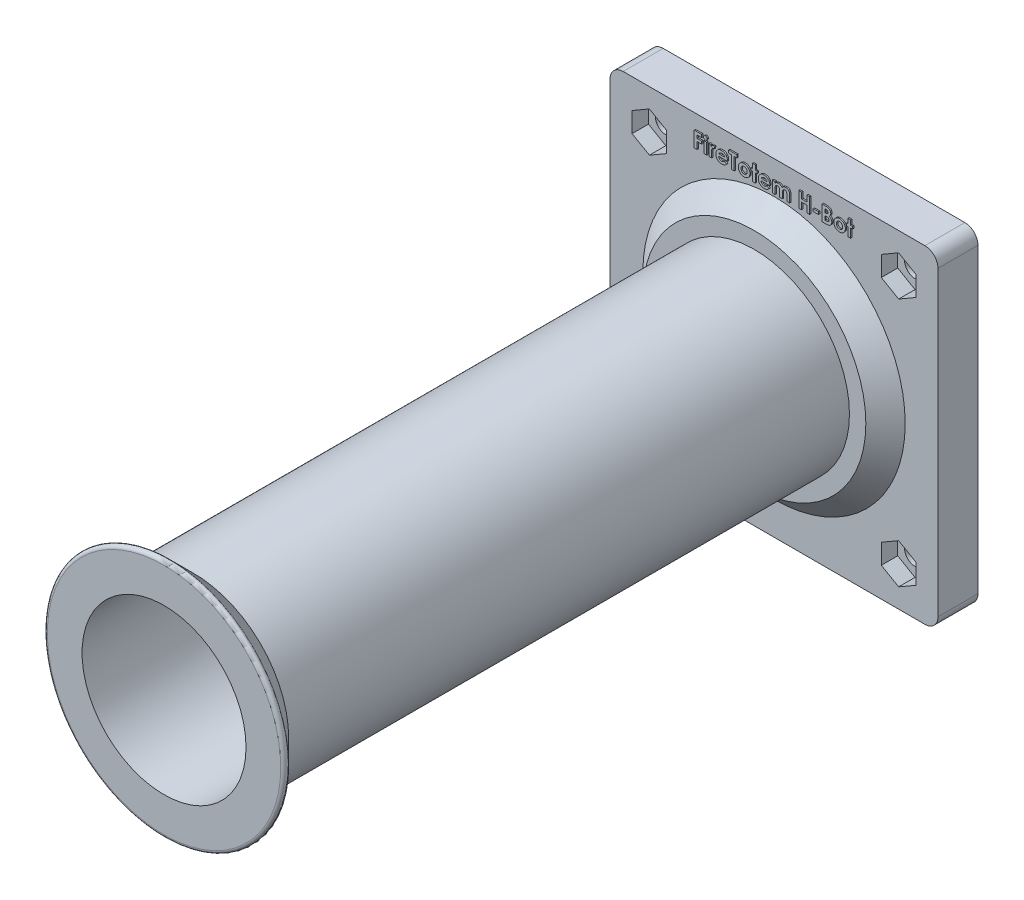
from build123d import *

# Parameters (mm, degrees)
SKETCH_1_R          = 1.6
SKETCH_1_R_2        = 12.5
EXTRUDE_1_DEPTH     = 6.1
CUT_EXTRUDE_1_DEPTH = 2.5
SKETCH_3_R          = 20
EXTRUDE_2_DEPTH     = 3
SKETCH_4_R          = 14.5
EXTRUDE_3_DEPTH     = 85
SKETCH_5_R          = 20
EXTRUDE_4_DEPTH     = 5
SKETCH_6_R          = 12.5
CUT_EXTRUDE_2_DEPTH = 106.217916725
CHAMFER_1_SIZE      = 3
CHAMFER_2_SIZE      = 6
FILLET_1_R          = 0.5
SKETCH_7_W          = 0.421794872
SKETCH_7_H          = 1.717307692
SKETCH_7_W_2        = 0.813461538
SKETCH_7_H_2        = 0.391666666
EXTRUDE_5_DEPTH     = 0.2


# Some blends are built 0.0001 mm under size
with BuildPart() as part:
    # Эскиз1 → Бобышка-Вытянуть1 (new body)
    with BuildSketch(Plane.XY):
        with BuildLine():
            Line((-23, 25), (23, 25))
            ThreePointArc((23, 25), (24.414213562, 24.414213562), (25, 23))
            Line((25, 23), (25, -23))
            ThreePointArc((25, -23), (24.414213562, -24.414213562), (23, -25))
            Line((23, -25), (-23, -25))
            ThreePointArc((-23, -25), (-24.414213562, -24.414213562), (-25, -23))
            Line((-25, -23), (-25, 23))
            ThreePointArc((-25, 23), (-24.414213562, 24.414213562), (-23, 25))
        make_face()
        with Locations((-19, 19)):
            Circle(SKETCH_1_R, mode=Mode.SUBTRACT)
        with Locations((19, 19)):
            Circle(SKETCH_1_R, mode=Mode.SUBTRACT)
        with Locations((19, -19)):
            Circle(SKETCH_1_R, mode=Mode.SUBTRACT)
        with Locations((-19, -19)):
            Circle(SKETCH_1_R, mode=Mode.SUBTRACT)
        Circle(SKETCH_1_R_2, mode=Mode.SUBTRACT)
    extrude(amount=EXTRUDE_1_DEPTH)

    # Эскиз2 → Вырез-Вытянуть1 (cut)
    with BuildSketch(Plane.XY.offset(6.1)):
        Polygon((-19, 15.95), (-16.358622518, 17.475), (-16.358622518, 20.525), (-19, 22.05), (-21.641377482, 20.525), (-21.641377482, 17.475), align=None)
        Polygon((-19, -22.05), (-16.358622518, -20.525), (-16.358622518, -17.475), (-19, -15.95), (-21.641377482, -17.475), (-21.641377482, -20.525), align=None)
        Polygon((19, 15.95), (21.641377482, 17.475), (21.641377482, 20.525), (19, 22.05), (16.358622518, 20.525), (16.358622518, 17.475), align=None)
        Polygon((19, -22.05), (21.641377482, -20.525), (21.641377482, -17.475), (19, -15.95), (16.358622518, -17.475), (16.358622518, -20.525), align=None)
    extrude(amount=-CUT_EXTRUDE_1_DEPTH, mode=Mode.SUBTRACT)

    # Эскиз3 → Бобышка-Вытянуть2 (add)
    with BuildSketch(Plane.XY.offset(6.1)):
        Circle(SKETCH_3_R)
    extrude(amount=EXTRUDE_2_DEPTH)

    # Эскиз4 → Бобышка-Вытянуть3 (add)
    with BuildSketch(Plane.XY.offset(9.1)):
        Circle(SKETCH_4_R)
    extrude(amount=EXTRUDE_3_DEPTH)

    # Эскиз5 → Бобышка-Вытянуть4 (add)
    with BuildSketch(Plane.XY.offset(94.1)):
        Circle(SKETCH_5_R)
    extrude(amount=EXTRUDE_4_DEPTH)

    # Эскиз6 → Вырез-Вытянуть2 (cut, through all)
    with BuildSketch(Plane.XY.offset(99.1)):
        Circle(SKETCH_6_R)
    extrude(amount=-CUT_EXTRUDE_2_DEPTH, mode=Mode.SUBTRACT)

    # Фаска1
    chamfer_1_edges = [part.edges().sort_by_distance(p)[0] for p in [
        (-20, 0, 9.1),
    ]]
    chamfer(chamfer_1_edges, length=CHAMFER_1_SIZE - 0.0001)  # a hair under: the kernel refuses the full size

    # Фаска2
    # the kernel refuses this chamfer: 6 mm, written as the material it takes off along each edge
    with BuildSketch(Plane(origin=(0, 0, 94.1), x_dir=(1, 0, 0), z_dir=(0, -1, 0))) as chamfer_2_piece_1_section:
        Polygon((20 - CHAMFER_2_SIZE, 0), (20, CHAMFER_2_SIZE), (20, 0), align=None)
    chamfer_2_piece_1 = revolve(axis=Axis((0, 0, 94.1), (0, 0, 1)), mode=Mode.PRIVATE)
    chamfer_2_piece_1 = chamfer_2_piece_1 - Plane(origin=(0, 0, 97.342648178), x_dir=(1, 0, 0), z_dir=(0, 0, -1)) * Cylinder(14.5, 80, mode=Mode.PRIVATE)
    add(chamfer_2_piece_1, mode=Mode.SUBTRACT)

    # Скругление1
    fillet_1_edges = [part.edges().sort_by_distance(p)[0] for p in [
        (-19, 0, 99.1),
    ]]
    fillet(fillet_1_edges, radius=FILLET_1_R)

    # Эскиз7 → Бобышка-Вытянуть5 (add)
    # profile 1 of 15: a face of its own
    with BuildSketch(Plane.XY.offset(6.1)):
        Polygon((-11.965308917, 22.875), (-10.820437122, 22.875), (-10.820437122, 22.453205128), (-11.543514045, 22.453205128), (-11.543514045, 22.001282051), (-10.820437122, 22.001282051), (-10.820437122, 21.579487179), (-11.543514045, 21.579487179), (-11.543514045, 20.525), (-11.965308917, 20.525), align=None)
    # profile 2 of 15: a face of its own
    with BuildSketch(Plane.XY.offset(6.1)):
        with BuildLine():
            add(Edge.make_bspline(
                [(-10.279070936, 22.965384615), (-10.26089158, 22.964492667), (-10.225194663, 22.962741242), (-10.174053972, 22.945668735), (-10.127117182, 22.918873947), (-10.085623758, 22.882110859), (-10.051113408, 22.838209008), (-10.024746218, 22.789057967), (-10.010058156, 22.734600197), (-10.008018201, 22.696981338), (-10.006975584, 22.677754407)],
                knots=[0, 0, 0, 0, 0.989868614, 1.943702388, 2.910836514, 3.924849579, 4.949916355, 5.946401046, 6.950409252, 8, 8, 8, 8], degree=3))
            add(Edge.make_bspline(
                [(-10.006975584, 22.677754407), (-10.007980898, 22.658669168), (-10.0099398, 22.62148067), (-10.025084273, 22.567762189), (-10.050393175, 22.518635021), (-10.085183038, 22.475385194), (-10.126226619, 22.439214197), (-10.172137804, 22.411932966), (-10.222788419, 22.395810199), (-10.257931428, 22.393912364), (-10.275775664, 22.392948718)],
                knots=[0, 0, 0, 0, 1.05296456, 2.051751585, 3.055639087, 4.085634717, 5.099016424, 6.062201612, 7.016062274, 8, 8, 8, 8], degree=3))
            add(Edge.make_bspline(
                [(-10.275775664, 22.392948718), (-10.294113711, 22.393837477), (-10.33012119, 22.395582592), (-10.38168134, 22.412695044), (-10.429244147, 22.439278805), (-10.470557573, 22.47679302), (-10.505463143, 22.521006827), (-10.530678603, 22.571302147), (-10.546451497, 22.626132299), (-10.548323726, 22.664308318), (-10.549283276, 22.683874199)],
                knots=[0, 0, 0, 0, 0.989065327, 1.942068821, 2.907541208, 3.917690034, 4.939857478, 5.938239964, 6.943311734, 8, 8, 8, 8], degree=3))
            add(Edge.make_bspline(
                [(-10.549283276, 22.683874199), (-10.548239023, 22.702635359), (-10.546187739, 22.739488951), (-10.531411694, 22.792735965), (-10.505649103, 22.841060701), (-10.471387334, 22.884158887), (-10.430258362, 22.920236205), (-10.383349749, 22.946217218), (-10.332553236, 22.962584581), (-10.297082446, 22.964441633), (-10.279070936, 22.965384615)],
                knots=[0, 0, 0, 0, 1.038616768, 2.040212704, 3.031499824, 4.052181184, 5.074969369, 6.039807101, 7.004644834, 8, 8, 8, 8], degree=3))
        make_face()
    # profile 3 of 15: a face of its own
    with BuildSketch(Plane.XY.offset(6.1)):
        with Locations((-10.27812943, 21.383653846)):
            Rectangle(SKETCH_7_W, SKETCH_7_H)
    # profile 4 of 15: a face of its own
    with BuildSketch(Plane.XY.offset(6.1)):
        with BuildLine():
            Line((-9.735821738, 22.242307692), (-9.374283276, 22.242307692))
            Line((-9.374283276, 22.242307692), (-9.374283276, 22.030939503))
            add(Edge.make_bspline(
                [(-9.374283276, 22.030939503), (-9.364056047, 22.049723852), (-9.344066504, 22.086438642), (-9.307344036, 22.135720976), (-9.265155778, 22.177225183), (-9.219017684, 22.211819361), (-9.168789918, 22.238782126), (-9.115817491, 22.257996495), (-9.06055358, 22.270483173), (-9.022854414, 22.271780302), (-9.003800504, 22.272435897)],
                knots=[0, 0, 0, 0, 1.09866127, 2.147379032, 3.14564304, 4.131443017, 5.102343063, 6.064490016, 7.021754664, 8, 8, 8, 8], degree=3))
            add(Edge.make_bspline(
                [(-9.003800504, 22.272435897), (-8.989964987, 22.271788032), (-8.961790936, 22.270468748), (-8.918849716, 22.262799727), (-8.87528893, 22.248932679), (-8.84662218, 22.236447245), (-8.831975584, 22.230068109)],
                knots=[0, 0, 0, 0, 0.931404136, 1.896671404, 2.925354185, 4, 4, 4, 4], degree=3))
            Line((-8.831975584, 22.230068109), (-8.962844975, 21.872766426))
            add(Edge.make_bspline(
                [(-8.962844975, 21.872766426), (-8.97454283, 21.878418264), (-8.996530293, 21.889041544), (-9.028452273, 21.901578108), (-9.057422793, 21.909227306), (-9.075789571, 21.910368634), (-9.084299302, 21.910897436)],
                knots=[0, 0, 0, 0, 1.214386998, 2.282580073, 3.20428172, 4, 4, 4, 4], degree=3))
            add(Edge.make_bspline(
                [(-9.084299302, 21.910897436), (-9.092334142, 21.910547024), (-9.108140058, 21.909857703), (-9.131469148, 21.903950455), (-9.153440292, 21.893763589), (-9.17511228, 21.880713204), (-9.194775431, 21.862572191), (-9.214426436, 21.841570749), (-9.231743954, 21.815641674), (-9.250018958, 21.786781297), (-9.265579471, 21.751456222), (-9.278922131, 21.709285362), (-9.290810548, 21.659780771), (-9.298991403, 21.602679605), (-9.306898527, 21.538534414), (-9.311605041, 21.466874383), (-9.315112866, 21.387926106), (-9.315327346, 21.332817359), (-9.315439126, 21.304096554)],
                knots=[0, 0, 0, 0, 0.544232178, 1.070598461, 1.618251235, 2.182094276, 2.777567932, 3.425210017, 4.127676488, 4.886675562, 5.738955394, 6.734782583, 7.883056018, 9.186093582, 10.642914445, 12.264202625, 14.053029461, 16, 16, 16, 16], degree=3))
            Line((-9.315439126, 21.304096554), (-9.314026866, 21.220302484))
            Line((-9.314026866, 21.220302484), (-9.314026866, 20.525))
            Line((-9.314026866, 20.525), (-9.735821738, 20.525))
            Line((-9.735821738, 20.525), (-9.735821738, 22.242307692))
        make_face()
    # profile 5 of 15: a face of its own
    with BuildSketch(Plane.XY.offset(6.1)):
        with BuildLine():
            Line((-6.905182715, 21.278205128), (-8.259539686, 21.278205128))
            add(Edge.make_bspline(
                [(-8.259539686, 21.278205128), (-8.256778262, 21.262468269), (-8.251351845, 21.231544098), (-8.239568188, 21.186624056), (-8.224530473, 21.144292167), (-8.20650872, 21.104491844), (-8.185806774, 21.067012677), (-8.161659669, 21.032030458), (-8.134373689, 20.999576087), (-8.104106594, 20.969790612), (-8.071362883, 20.943102182), (-8.036301349, 20.919721429), (-7.998885811, 20.900550643), (-7.959545226, 20.884391659), (-7.917985627, 20.871592107), (-7.874145849, 20.862764499), (-7.828142106, 20.857549999), (-7.79680295, 20.856795781), (-7.780783677, 20.856410256)],
                knots=[0, 0, 0, 0, 1.091296461, 2.144483647, 3.168565212, 4.157007626, 5.126487748, 6.090021542, 7.05641414, 8.019231907, 8.98705074, 9.938580405, 10.892824166, 11.854447369, 12.841318655, 13.858982407, 14.905600794, 16, 16, 16, 16], degree=3))
            add(Edge.make_bspline(
                [(-7.780783677, 20.856410256), (-7.761447326, 20.856920755), (-7.723368357, 20.857926076), (-7.667582384, 20.866841785), (-7.613629222, 20.880308572), (-7.562019457, 20.900334815), (-7.512155273, 20.925263966), (-7.464857586, 20.956322621), (-7.41930771, 20.992603145), (-7.391516918, 21.020568159), (-7.37734818, 21.034825721)],
                knots=[0, 0, 0, 0, 1.021034703, 2.010718019, 2.977989445, 3.954245119, 4.929443971, 5.918328161, 6.938689359, 8, 8, 8, 8], degree=3))
            Line((-7.37734818, 21.034825721), (-7.024283276, 20.866766827))
            add(Edge.make_bspline(
                [(-7.024283276, 20.866766827), (-7.035399319, 20.851406162), (-7.057425348, 20.82096957), (-7.093382102, 20.778137425), (-7.130905264, 20.738173295), (-7.170022819, 20.701340032), (-7.210784378, 20.667742595), (-7.253076552, 20.636971707), (-7.297517424, 20.609853555), (-7.343218407, 20.585076177), (-7.391124224, 20.563834646), (-7.4411023, 20.545720619), (-7.492940948, 20.529345692), (-7.54729478, 20.516868895), (-7.603711191, 20.506992364), (-7.662325139, 20.499978718), (-7.723128901, 20.495646726), (-7.764456864, 20.495133173), (-7.785491209, 20.494871795)],
                knots=[0, 0, 0, 0, 1.028154879, 2.037251081, 3.030720504, 4.000128189, 4.949298328, 5.894184978, 6.834267904, 7.770992897, 8.712077017, 9.673380525, 10.653304757, 11.658697181, 12.695551717, 13.758623199, 14.859225354, 16, 16, 16, 16], degree=3))
            add(Edge.make_bspline(
                [(-7.785491209, 20.494871795), (-7.817852203, 20.495531538), (-7.881229344, 20.496823607), (-7.97392987, 20.508815859), (-8.061969659, 20.528700305), (-8.145597303, 20.555730155), (-8.224451309, 20.591418026), (-8.298570701, 20.635067252), (-8.368696038, 20.68584099), (-8.432684601, 20.744804846), (-8.490980069, 20.808983498), (-8.542183184, 20.877906988), (-8.585029221, 20.951093774), (-8.620215248, 21.028059489), (-8.647563051, 21.109001136), (-8.667279231, 21.193954036), (-8.679365485, 21.282877615), (-8.680670861, 21.343444498), (-8.681334558, 21.374238782)],
                knots=[0, 0, 0, 0, 1.103565453, 2.161269334, 3.182010356, 4.179077853, 5.15417608, 6.128274628, 7.109042802, 8.101804412, 9.090965879, 10.063106201, 11.02526161, 11.978650795, 12.945248442, 13.93468508, 14.949922959, 16, 16, 16, 16], degree=3))
            add(Edge.make_bspline(
                [(-8.681334558, 21.374238782), (-8.680664328, 21.405815588), (-8.679345681, 21.467941536), (-8.667383293, 21.5589184), (-8.647508543, 21.645722635), (-8.620080741, 21.728473777), (-8.58542849, 21.807430637), (-8.542037311, 21.881902437), (-8.491005478, 21.952148447), (-8.432920018, 22.017840051), (-8.368660381, 22.077133899), (-8.300378445, 22.129976568), (-8.227306993, 22.174008587), (-8.150272526, 22.209586431), (-8.069767784, 22.238492532), (-7.984862245, 22.257727127), (-7.896201911, 22.270642007), (-7.835595659, 22.271831386), (-7.80479209, 22.272435897)],
                knots=[0, 0, 0, 0, 1.079208495, 2.12329425, 3.130605359, 4.119693003, 5.099659317, 6.073216462, 7.060498243, 8.06384408, 9.066070512, 10.045757761, 11.010926815, 11.975797609, 12.942977511, 13.929384301, 14.947594487, 16, 16, 16, 16], degree=3))
            add(Edge.make_bspline(
                [(-7.80479209, 22.272435897), (-7.772276065, 22.271765919), (-7.708434201, 22.270450485), (-7.615088045, 22.258555607), (-7.526463683, 22.238549908), (-7.442183526, 22.21175378), (-7.363323867, 22.175164397), (-7.28815192, 22.132589309), (-7.218470734, 22.080718058), (-7.153537582, 22.022042752), (-7.094922141, 21.956944533), (-7.043685752, 21.886227929), (-7.000089891, 21.810583093), (-6.964755012, 21.729703268), (-6.937435291, 21.643831264), (-6.91770086, 21.553078603), (-6.905706795, 21.457100104), (-6.90442571, 21.391378125), (-6.903770456, 21.35776242)],
                knots=[0, 0, 0, 0, 1.080001299, 2.120471247, 3.119684163, 4.095710327, 5.052285597, 6.002875087, 6.961153713, 7.931888285, 8.906493152, 9.865905668, 10.82813294, 11.801621613, 12.7925306, 13.817193356, 14.883530496, 16, 16, 16, 16], degree=3))
            Line((-6.903770456, 21.35776242), (-6.905182715, 21.278205128))
        make_face()
        with BuildLine():
            add(Edge.make_bspline(
                [(-7.325565327, 21.609615385), (-7.333524855, 21.631094924), (-7.349350468, 21.673801845), (-7.385099871, 21.732726974), (-7.432538184, 21.783758529), (-7.487712345, 21.82893717), (-7.550752279, 21.865606977), (-7.619671488, 21.892157108), (-7.693598844, 21.908076899), (-7.744456882, 21.909944011), (-7.770427106, 21.910897436)],
                knots=[0, 0, 0, 0, 0.954238005, 1.897273737, 2.851915805, 3.847685534, 4.862635127, 5.880135777, 6.917509367, 8, 8, 8, 8], degree=3))
            add(Edge.make_bspline(
                [(-7.770427106, 21.910897436), (-7.79879082, 21.909981555), (-7.854235973, 21.908191199), (-7.934211832, 21.889150108), (-8.009651059, 21.860731847), (-8.054125752, 21.831432016), (-8.07641669, 21.816746795)],
                knots=[0, 0, 0, 0, 1.044195649, 2.041185066, 3.018232172, 4, 4, 4, 4], degree=3))
            add(Edge.make_bspline(
                [(-8.07641669, 21.816746795), (-8.09032457, 21.805562209), (-8.11997546, 21.781717243), (-8.158483157, 21.734148799), (-8.196413558, 21.676554092), (-8.217979083, 21.632806844), (-8.229411481, 21.609615385)],
                knots=[0, 0, 0, 0, 0.82159062, 1.751589201, 2.808063854, 4, 4, 4, 4], degree=3))
            Line((-8.229411481, 21.609615385), (-7.325565327, 21.609615385))
        make_face(mode=Mode.SUBTRACT)
    # profile 6 of 15: a face of its own
    with BuildSketch(Plane.XY.offset(6.1)):
        Polygon((-6.723001225, 22.875), (-5.45761661, 22.875), (-5.45761661, 22.453205128), (-5.879411481, 22.453205128), (-5.879411481, 20.525), (-6.301206353, 20.525), (-6.301206353, 22.453205128), (-6.723001225, 22.453205128), align=None)
    # profile 7 of 15: a face of its own
    with BuildSketch(Plane.XY.offset(6.1)):
        with BuildLine():
            add(Edge.make_bspline(
                [(-4.368293693, 22.272435897), (-4.348352046, 22.272081022), (-4.308858548, 22.271378208), (-4.250037917, 22.265527925), (-4.192245606, 22.255982947), (-4.135149434, 22.243623866), (-4.07927959, 22.226306946), (-4.024343044, 22.205537977), (-3.969848595, 22.181692772), (-3.917148783, 22.153308638), (-3.865862892, 22.122523456), (-3.817240815, 22.088564874), (-3.771686324, 22.051699626), (-3.728353775, 22.01278246), (-3.689262532, 21.970119052), (-3.651914457, 21.925765102), (-3.618327374, 21.878131564), (-3.587230574, 21.828379157), (-3.559545317, 21.776795588), (-3.535505762, 21.723739693), (-3.514641689, 21.669945005), (-3.498305538, 21.61475627), (-3.48478071, 21.558901223), (-3.476245583, 21.501695403), (-3.470177699, 21.443726458), (-3.469497297, 21.404696994), (-3.469155071, 21.385066106)],
                knots=[0, 0, 0, 0, 1.022364134, 2.024744242, 3.027414945, 4.024939316, 5.017584196, 6.023349371, 7.035562955, 8.064994934, 9.090267829, 10.101425541, 11.102933353, 12.093946398, 13.084502048, 14.067315274, 15.065326281, 16.070028806, 17.074376865, 18.064572984, 19.055292013, 20.030201733, 21.013838017, 21.999348303, 22.993720005, 24, 24, 24, 24], degree=3))
            add(Edge.make_bspline(
                [(-3.469155071, 21.385066106), (-3.469516234, 21.365281852), (-3.470234308, 21.325946269), (-3.476026054, 21.267432054), (-3.485607568, 21.209957222), (-3.498014083, 21.153183179), (-3.515266199, 21.097836403), (-3.535423455, 21.04310106), (-3.560167279, 20.989723214), (-3.5875234, 20.937120563), (-3.61882014, 20.886841042), (-3.652378149, 20.838730331), (-3.689569792, 20.794050599), (-3.728348098, 20.751416204), (-3.77055241, 20.71226885), (-3.815509069, 20.675972888), (-3.862828873, 20.642084585), (-3.912852104, 20.611399023), (-3.964938046, 20.584436713), (-4.01820828, 20.560127991), (-4.072974301, 20.539889245), (-4.129122767, 20.523385104), (-4.186687731, 20.510606361), (-4.245542105, 20.501925609), (-4.305559136, 20.495888246), (-4.345996249, 20.495212793), (-4.36641068, 20.494871795)],
                knots=[0, 0, 0, 0, 1.012026251, 2.012137606, 3.004615893, 3.992048833, 4.982446996, 5.968083444, 6.973977695, 7.990229942, 8.999482246, 10.001782172, 10.988562221, 11.971415814, 12.948383116, 13.930088534, 14.925840678, 15.924049238, 16.929462851, 17.924729459, 18.917889337, 19.913673841, 20.916777188, 21.931792057, 22.95587778, 24, 24, 24, 24], degree=3))
            add(Edge.make_bspline(
                [(-4.36641068, 20.494871795), (-4.396260741, 20.495747953), (-4.455095665, 20.497474874), (-4.541745598, 20.509303831), (-4.62498758, 20.529664568), (-4.704957252, 20.558046986), (-4.781758498, 20.594417998), (-4.854721058, 20.639432647), (-4.92457071, 20.692204726), (-4.990097605, 20.752288199), (-5.050129117, 20.81820521), (-5.102573867, 20.888571217), (-5.147103703, 20.962331553), (-5.183678562, 21.039570329), (-5.211906896, 21.12039346), (-5.232292569, 21.204559314), (-5.244135988, 21.292304467), (-5.245848303, 21.351921056), (-5.246719174, 21.382241587)],
                knots=[0, 0, 0, 0, 1.029999031, 2.030143771, 3.011211297, 3.982305373, 4.953580601, 5.938004764, 6.935448627, 7.970290061, 9.001484052, 10.007591832, 10.993831261, 11.969999897, 12.951306496, 13.942897864, 14.953773953, 16, 16, 16, 16], degree=3))
            add(Edge.make_bspline(
                [(-5.246719174, 21.382241587), (-5.245817934, 21.414617266), (-5.244046564, 21.478251017), (-5.229981113, 21.571475912), (-5.207520104, 21.66073433), (-5.175278741, 21.745776589), (-5.134093235, 21.826759536), (-5.083815066, 21.903512369), (-5.024195756, 21.976052475), (-4.978539303, 22.019927218), (-4.95532294, 22.04223758)],
                knots=[0, 0, 0, 0, 1.043912699, 2.05178951, 3.033892, 4.007821512, 4.978932272, 5.95884105, 6.962068106, 8, 8, 8, 8], degree=3))
            add(Edge.make_bspline(
                [(-4.95532294, 22.04223758), (-4.934019605, 22.060730361), (-4.891992537, 22.097212788), (-4.823712382, 22.143484767), (-4.753801209, 22.18344964), (-4.681421101, 22.216308198), (-4.606370282, 22.241083021), (-4.529033344, 22.259116876), (-4.449426369, 22.270193798), (-4.395475354, 22.271684733), (-4.368293693, 22.272435897)],
                knots=[0, 0, 0, 0, 1.048115528, 2.067714963, 3.060638214, 4.039924844, 5.017819947, 5.994373833, 6.98952318, 8, 8, 8, 8], degree=3))
        make_face()
        with BuildLine():
            add(Edge.make_bspline(
                [(-4.358878629, 21.880769231), (-4.375209369, 21.880226451), (-4.407356606, 21.879157983), (-4.454678184, 21.873423803), (-4.499435431, 21.861671107), (-4.542517309, 21.846724894), (-4.583161695, 21.826736441), (-4.622481695, 21.803345344), (-4.658432755, 21.774074264), (-4.692754662, 21.741966032), (-4.723911303, 21.706310701), (-4.750459719, 21.667464245), (-4.774181318, 21.626912847), (-4.792168203, 21.583171871), (-4.80705407, 21.537436884), (-4.817128646, 21.488968948), (-4.824139848, 21.438309476), (-4.82466033, 21.40360739), (-4.824924302, 21.386007612)],
                knots=[0, 0, 0, 0, 1.030650113, 2.02884584, 2.99876339, 3.944280128, 4.900564847, 5.851248946, 6.823638398, 7.81794922, 8.81432732, 9.802856497, 10.78262424, 11.771747962, 12.779760563, 13.812642396, 14.89064281, 16, 16, 16, 16], degree=3))
            add(Edge.make_bspline(
                [(-4.824924302, 21.386007612), (-4.824615419, 21.367787177), (-4.824011766, 21.332178837), (-4.817760819, 21.280185871), (-4.8074528, 21.230844892), (-4.792808336, 21.184232119), (-4.77439045, 21.140012972), (-4.751793839, 21.098435552), (-4.724780022, 21.059749845), (-4.69415291, 21.024003492), (-4.660617531, 20.991556132), (-4.623872084, 20.963711021), (-4.58545533, 20.939517316), (-4.54448194, 20.920086036), (-4.501533851, 20.905083512), (-4.45648357, 20.894037658), (-4.409094357, 20.888086687), (-4.376782403, 20.887061633), (-4.360290888, 20.886538462)],
                knots=[0, 0, 0, 0, 1.141730614, 2.231293227, 3.276944405, 4.297399982, 5.28939179, 6.275415646, 7.257752684, 8.24146775, 9.222424823, 10.176631434, 11.126518621, 12.063689483, 13.012557477, 13.974037417, 14.965980454, 16, 16, 16, 16], degree=3))
            add(Edge.make_bspline(
                [(-4.360290888, 20.886538462), (-4.343791125, 20.887002491), (-4.311442011, 20.887912258), (-4.263997149, 20.894724977), (-4.218716808, 20.905446854), (-4.175401909, 20.9205785), (-4.134402658, 20.940425696), (-4.095562105, 20.964735147), (-4.058538565, 20.992967558), (-4.024553138, 21.026027138), (-3.993093478, 21.061884972), (-3.965505237, 21.100774897), (-3.942451463, 21.142352329), (-3.923543241, 21.186355661), (-3.908870068, 21.232724411), (-3.898732701, 21.281630926), (-3.891717751, 21.332923641), (-3.89120904, 21.368094426), (-3.890949943, 21.386007612)],
                knots=[0, 0, 0, 0, 1.031504075, 2.022346795, 2.991027682, 3.937587355, 4.885570121, 5.833146507, 6.798790848, 7.791235734, 8.792807298, 9.778388351, 10.766749885, 11.760164525, 12.768777521, 13.802286646, 14.880660483, 16, 16, 16, 16], degree=3))
            add(Edge.make_bspline(
                [(-3.890949943, 21.386007612), (-3.891262755, 21.403914538), (-3.891876595, 21.439053735), (-3.898127988, 21.490415823), (-3.908334846, 21.539164259), (-3.923168192, 21.58509089), (-3.941476605, 21.628719668), (-3.964088834, 21.669827272), (-3.991235875, 21.708211237), (-4.022011873, 21.743681235), (-4.056049969, 21.775673285), (-4.092157426, 21.804202427), (-4.131159912, 21.82779822), (-4.172325716, 21.847249576), (-4.215764361, 21.862214618), (-4.261427079, 21.873323072), (-4.309453813, 21.879189363), (-4.342231507, 21.880237104), (-4.358878629, 21.880769231)],
                knots=[0, 0, 0, 0, 1.123894411, 2.205445421, 3.243160173, 4.246488011, 5.231014757, 6.210004299, 7.185865357, 8.177612767, 9.153374344, 10.115157457, 11.061423229, 12.009021698, 12.96873347, 13.94135618, 14.954456845, 16, 16, 16, 16], degree=3))
        make_face(mode=Mode.SUBTRACT)
    # profile 8 of 15: a face of its own
    with BuildSketch(Plane.XY.offset(6.1)):
        Polygon((-3.077488404, 22.93525641), (-2.655693533, 22.93525641), (-2.655693533, 22.242307692), (-2.384539686, 22.242307692), (-2.384539686, 21.880769231), (-2.655693533, 21.880769231), (-2.655693533, 20.525), (-3.077488404, 20.525), (-3.077488404, 21.880769231), (-3.28838584, 21.880769231), (-3.28838584, 22.242307692), (-3.077488404, 22.242307692), align=None)
    # profile 9 of 15: a face of its own
    with BuildSketch(Plane.XY.offset(6.1)):
        with BuildLine():
            Line((-0.427618613, 21.278205128), (-1.781975584, 21.278205128))
            add(Edge.make_bspline(
                [(-1.781975584, 21.278205128), (-1.779214159, 21.262468269), (-1.773787742, 21.231544098), (-1.762004085, 21.186624056), (-1.746966371, 21.144292167), (-1.728944617, 21.104491844), (-1.708242671, 21.067012677), (-1.684095566, 21.032030458), (-1.656809586, 20.999576087), (-1.626542492, 20.969790612), (-1.59379878, 20.943102182), (-1.558737246, 20.919721429), (-1.521321709, 20.900550643), (-1.481981123, 20.884391659), (-1.440421524, 20.871592107), (-1.396581747, 20.862764499), (-1.350578003, 20.857549999), (-1.319238848, 20.856795781), (-1.303219574, 20.856410256)],
                knots=[0, 0, 0, 0, 1.091296461, 2.144483647, 3.168565212, 4.157007626, 5.126487748, 6.090021542, 7.05641414, 8.019231907, 8.98705074, 9.938580405, 10.892824166, 11.854447369, 12.841318655, 13.858982407, 14.905600794, 16, 16, 16, 16], degree=3))
            add(Edge.make_bspline(
                [(-1.303219574, 20.856410256), (-1.283883224, 20.856920755), (-1.245804254, 20.857926076), (-1.190018281, 20.866841785), (-1.136065119, 20.880308572), (-1.084455355, 20.900334815), (-1.03459117, 20.925263966), (-0.987293483, 20.956322621), (-0.941743607, 20.992603145), (-0.913952816, 21.020568159), (-0.899784077, 21.034825721)],
                knots=[0, 0, 0, 0, 1.021034703, 2.010718019, 2.977989445, 3.954245119, 4.929443971, 5.918328161, 6.938689359, 8, 8, 8, 8], degree=3))
            Line((-0.899784077, 21.034825721), (-0.546719174, 20.866766827))
            add(Edge.make_bspline(
                [(-0.546719174, 20.866766827), (-0.557835216, 20.851406162), (-0.579861245, 20.82096957), (-0.615817999, 20.778137425), (-0.653341161, 20.738173295), (-0.692458716, 20.701340032), (-0.733220275, 20.667742595), (-0.775512449, 20.636971707), (-0.819953322, 20.609853555), (-0.865654304, 20.585076177), (-0.913560122, 20.563834646), (-0.963538197, 20.545720619), (-1.015376846, 20.529345692), (-1.069730677, 20.516868895), (-1.126147088, 20.506992364), (-1.184761037, 20.499978718), (-1.245564799, 20.495646726), (-1.286892762, 20.495133173), (-1.307927106, 20.494871795)],
                knots=[0, 0, 0, 0, 1.028154879, 2.037251081, 3.030720504, 4.000128189, 4.949298328, 5.894184978, 6.834267904, 7.770992897, 8.712077017, 9.673380525, 10.653304757, 11.658697181, 12.695551717, 13.758623199, 14.859225354, 16, 16, 16, 16], degree=3))
            add(Edge.make_bspline(
                [(-1.307927106, 20.494871795), (-1.3402881, 20.495531538), (-1.403665242, 20.496823607), (-1.496365768, 20.508815859), (-1.584405556, 20.528700305), (-1.6680332, 20.555730155), (-1.746887206, 20.591418026), (-1.821006598, 20.635067252), (-1.891131936, 20.68584099), (-1.955120498, 20.744804846), (-2.013415966, 20.808983498), (-2.064619081, 20.877906988), (-2.107465118, 20.951093774), (-2.142651146, 21.028059489), (-2.169998949, 21.109001136), (-2.189715128, 21.193954036), (-2.201801382, 21.282877615), (-2.203106758, 21.343444498), (-2.203770456, 21.374238782)],
                knots=[0, 0, 0, 0, 1.103565453, 2.161269334, 3.182010356, 4.179077853, 5.15417608, 6.128274628, 7.109042802, 8.101804412, 9.090965879, 10.063106201, 11.02526161, 11.978650795, 12.945248442, 13.93468508, 14.949922959, 16, 16, 16, 16], degree=3))
            add(Edge.make_bspline(
                [(-2.203770456, 21.374238782), (-2.203100226, 21.405815588), (-2.201781579, 21.467941536), (-2.189819191, 21.5589184), (-2.16994444, 21.645722635), (-2.142516639, 21.728473777), (-2.107864388, 21.807430637), (-2.064473208, 21.881902437), (-2.013441376, 21.952148447), (-1.955355916, 22.017840051), (-1.891096278, 22.077133899), (-1.822814342, 22.129976568), (-1.74974289, 22.174008587), (-1.672708423, 22.209586431), (-1.592203681, 22.238492532), (-1.507298143, 22.257727127), (-1.418637809, 22.270642007), (-1.358031557, 22.271831386), (-1.327227988, 22.272435897)],
                knots=[0, 0, 0, 0, 1.079208495, 2.12329425, 3.130605359, 4.119693003, 5.099659317, 6.073216462, 7.060498243, 8.06384408, 9.066070512, 10.045757761, 11.010926815, 11.975797609, 12.942977511, 13.929384301, 14.947594487, 16, 16, 16, 16], degree=3))
            add(Edge.make_bspline(
                [(-1.327227988, 22.272435897), (-1.294711963, 22.271765919), (-1.230870099, 22.270450485), (-1.137523942, 22.258555607), (-1.04889958, 22.238549908), (-0.964619424, 22.21175378), (-0.885759765, 22.175164397), (-0.810587817, 22.132589309), (-0.740906631, 22.080718058), (-0.675973479, 22.022042752), (-0.617358039, 21.956944533), (-0.566121649, 21.886227929), (-0.522525788, 21.810583093), (-0.48719091, 21.729703268), (-0.459871188, 21.643831264), (-0.440136758, 21.553078603), (-0.428142693, 21.457100104), (-0.426861607, 21.391378125), (-0.426206353, 21.35776242)],
                knots=[0, 0, 0, 0, 1.080001299, 2.120471247, 3.119684163, 4.095710327, 5.052285597, 6.002875087, 6.961153713, 7.931888285, 8.906493152, 9.865905668, 10.82813294, 11.801621613, 12.7925306, 13.817193356, 14.883530496, 16, 16, 16, 16], degree=3))
            Line((-0.426206353, 21.35776242), (-0.427618613, 21.278205128))
        make_face()
        with BuildLine():
            add(Edge.make_bspline(
                [(-0.848001225, 21.609615385), (-0.855960752, 21.631094924), (-0.871786366, 21.673801845), (-0.907535768, 21.732726974), (-0.954974081, 21.783758529), (-1.010148243, 21.82893717), (-1.073188177, 21.865606977), (-1.142107385, 21.892157108), (-1.216034742, 21.908076899), (-1.266892779, 21.909944011), (-1.292863004, 21.910897436)],
                knots=[0, 0, 0, 0, 0.954238005, 1.897273737, 2.851915805, 3.847685534, 4.862635127, 5.880135777, 6.917509367, 8, 8, 8, 8], degree=3))
            add(Edge.make_bspline(
                [(-1.292863004, 21.910897436), (-1.321226717, 21.909981555), (-1.376671871, 21.908191199), (-1.45664773, 21.889150108), (-1.532086957, 21.860731847), (-1.576561649, 21.831432016), (-1.598852587, 21.816746795)],
                knots=[0, 0, 0, 0, 1.044195649, 2.041185066, 3.018232172, 4, 4, 4, 4], degree=3))
            add(Edge.make_bspline(
                [(-1.598852587, 21.816746795), (-1.612760468, 21.805562209), (-1.642411358, 21.781717243), (-1.680919054, 21.734148799), (-1.718849456, 21.676554092), (-1.74041498, 21.632806844), (-1.751847379, 21.609615385)],
                knots=[0, 0, 0, 0, 0.82159062, 1.751589201, 2.808063854, 4, 4, 4, 4], degree=3))
            Line((-1.751847379, 21.609615385), (-0.848001225, 21.609615385))
        make_face(mode=Mode.SUBTRACT)
    # profile 10 of 15: a face of its own
    with BuildSketch(Plane.XY.offset(6.1)):
        with BuildLine():
            Line((-0.064667892, 22.242307692), (0.35712698, 22.242307692))
            Line((0.35712698, 22.242307692), (0.35712698, 22.037059295))
            add(Edge.make_bspline(
                [(0.35712698, 22.037059295), (0.375888202, 22.055994759), (0.412827505, 22.093277131), (0.474043157, 22.141206973), (0.53789728, 22.182192908), (0.605163685, 22.215373603), (0.675677842, 22.24070946), (0.749105551, 22.259275202), (0.825823965, 22.270228408), (0.878058837, 22.271691911), (0.904612958, 22.272435897)],
                knots=[0, 0, 0, 0, 1.041528618, 2.050684245, 3.032913108, 4.004406485, 4.976926473, 5.95771665, 6.961784757, 8, 8, 8, 8], degree=3))
            add(Edge.make_bspline(
                [(0.904612958, 22.272435897), (0.93120214, 22.271599549), (0.983542084, 22.269953225), (1.059905699, 22.254887814), (1.132248024, 22.230411613), (1.199773122, 22.195523795), (1.262969026, 22.152439154), (1.319036116, 22.0989318), (1.369503234, 22.037131746), (1.396404151, 21.990410241), (1.4102019, 21.966446314)],
                knots=[0, 0, 0, 0, 1.023965777, 2.015643508, 2.987309376, 3.958410333, 4.93654923, 5.924956801, 6.93568961, 8, 8, 8, 8], degree=3))
            add(Edge.make_bspline(
                [(1.4102019, 21.966446314), (1.427975184, 21.990475432), (1.462859152, 22.037637847), (1.524694163, 22.099213728), (1.591556259, 22.152444733), (1.664739067, 22.195841876), (1.742299105, 22.230292529), (1.823896981, 22.254796872), (1.9087929, 22.269928046), (1.966569232, 22.271593002), (1.995818887, 22.272435897)],
                knots=[0, 0, 0, 0, 1.041189987, 2.043563759, 3.033412161, 4.015238574, 5.00275396, 5.986226558, 6.980513695, 8, 8, 8, 8], degree=3))
            add(Edge.make_bspline(
                [(1.995818887, 22.272435897), (2.026030308, 22.271560681), (2.084864241, 22.269856278), (2.170123058, 22.253087937), (2.249978258, 22.227178334), (2.322665063, 22.189473521), (2.388390782, 22.144810677), (2.444397023, 22.092039662), (2.490877086, 22.033001884), (2.521141567, 21.977875004), (2.540706741, 21.929136529), (2.552520367, 21.886724924), (2.563569762, 21.839367003), (2.571507647, 21.786426209), (2.578917312, 21.728400144), (2.583218915, 21.664903031), (2.586142758, 21.596148778), (2.586453307, 21.548578085), (2.58661416, 21.523938301)],
                knots=[0, 0, 0, 0, 1.321991808, 2.574456155, 3.791773975, 4.987670122, 6.148905103, 7.262530793, 8.344737981, 9.427709016, 10.004683293, 10.642050061, 11.354108788, 12.133887687, 12.985666279, 13.916212488, 14.92067847, 16, 16, 16, 16], degree=3))
            Line((2.58661416, 21.523938301), (2.58661416, 20.525))
            Line((2.58661416, 20.525), (2.164819288, 20.525))
            Line((2.164819288, 20.525), (2.164819288, 21.387419872))
            add(Edge.make_bspline(
                [(2.164819288, 21.387419872), (2.164468224, 21.410488), (2.163794387, 21.454765188), (2.16092965, 21.518272361), (2.154517141, 21.575867887), (2.14700086, 21.62787079), (2.136244916, 21.674005346), (2.123129996, 21.714382768), (2.107916769, 21.749061177), (2.089547255, 21.778036959), (2.068973377, 21.802439145), (2.046087907, 21.82335665), (2.021129459, 21.841203422), (1.993871749, 21.856415258), (1.963600695, 21.866703324), (1.9313382, 21.874775708), (1.896831799, 21.880273059), (1.872974081, 21.880600795), (1.860712717, 21.880769231)],
                knots=[0, 0, 0, 0, 1.669139205, 3.203761885, 4.596586177, 5.860166715, 7.002923539, 8.018877315, 8.928339525, 9.734594377, 10.491888885, 11.231098709, 11.971440889, 12.708030942, 13.480072485, 14.275788656, 15.113863979, 16, 16, 16, 16], degree=3))
            add(Edge.make_bspline(
                [(1.860712717, 21.880769231), (1.841818129, 21.880115996), (1.804741259, 21.878834152), (1.750712704, 21.866584702), (1.699871434, 21.846558163), (1.652407924, 21.81931383), (1.609343482, 21.785286172), (1.571672997, 21.744926126), (1.54056243, 21.698001093), (1.519026937, 21.654464074), (1.505569958, 21.615097861), (1.496077284, 21.581383861), (1.488678121, 21.543258314), (1.482886743, 21.501107343), (1.477330592, 21.454692665), (1.474604775, 21.404072973), (1.471815433, 21.34931859), (1.471851744, 21.311476266), (1.47187057, 21.291856971)],
                knots=[0, 0, 0, 0, 1.129913425, 2.217230253, 3.297175357, 4.391411011, 5.481605898, 6.571841268, 7.681894157, 8.841607612, 9.468549532, 10.170608623, 10.93710061, 11.791434153, 12.717934886, 13.734733707, 14.825576123, 16, 16, 16, 16], degree=3))
            Line((1.47187057, 21.291856971), (1.47187057, 20.525))
            Line((1.47187057, 20.525), (1.050075698, 20.525))
            Line((1.050075698, 20.525), (1.050075698, 21.348347356))
            add(Edge.make_bspline(
                [(1.050075698, 21.348347356), (1.050040284, 21.366709086), (1.049972159, 21.402031107), (1.047924455, 21.453036781), (1.045212894, 21.500133527), (1.041411601, 21.543452704), (1.037027559, 21.582940436), (1.030700375, 21.618380697), (1.024053085, 21.649968772), (1.012656217, 21.685851884), (0.996596563, 21.725616376), (0.972603206, 21.767784406), (0.943591961, 21.803090194), (0.910296084, 21.831808493), (0.872670315, 21.853689532), (0.831667831, 21.869966306), (0.786505715, 21.878752009), (0.755419134, 21.880082634), (0.739378583, 21.880769231)],
                knots=[0, 0, 0, 0, 1.256487322, 2.417074606, 3.49288742, 4.484586665, 5.393016842, 6.210437544, 6.947749329, 7.599905853, 8.784490193, 9.876739139, 10.906602197, 11.896672079, 12.869113195, 13.872201355, 14.902064413, 16, 16, 16, 16], degree=3))
            add(Edge.make_bspline(
                [(0.739378583, 21.880769231), (0.72125414, 21.880154056), (0.685358529, 21.878935697), (0.633071089, 21.865849522), (0.583079446, 21.846190432), (0.536483368, 21.818186213), (0.494067694, 21.783357781), (0.456774371, 21.741849728), (0.425827301, 21.693711287), (0.404196216, 21.648973362), (0.390935457, 21.608625016), (0.381187538, 21.574035601), (0.374063671, 21.535070443), (0.368119904, 21.492167053), (0.362596648, 21.445274789), (0.359859552, 21.394187436), (0.357072967, 21.338961619), (0.357108542, 21.300805771), (0.35712698, 21.281029647)],
                knots=[0, 0, 0, 0, 1.07893236, 2.136834559, 3.195274846, 4.273923004, 5.364443877, 6.458052972, 7.587287137, 8.767908, 9.410170275, 10.118584836, 10.909717261, 11.770069756, 12.702352573, 13.724628867, 14.820678298, 16, 16, 16, 16], degree=3))
            Line((0.35712698, 21.281029647), (0.35712698, 20.525))
            Line((0.35712698, 20.525), (-0.064667892, 20.525))
            Line((-0.064667892, 20.525), (-0.064667892, 22.242307692))
        make_face()
    # profile 11 of 15: a face of its own
    with BuildSketch(Plane.XY.offset(6.1)):
        Polygon((3.972511596, 22.875), (4.394306467, 22.875), (4.394306467, 21.971153846), (5.207768006, 21.971153846), (5.207768006, 22.875), (5.629562878, 22.875), (5.629562878, 20.525), (5.207768006, 20.525), (5.207768006, 21.549358974), (4.394306467, 21.549358974), (4.394306467, 20.525), (3.972511596, 20.525), align=None)
    # profile 12 of 15: a face of its own
    with BuildSketch(Plane.XY.offset(6.1)):
        with Locations((6.578601339, 21.383653846)):
            Rectangle(SKETCH_7_W_2, SKETCH_7_H_2)
    # profile 13 of 15: a face of its own
    with BuildSketch(Plane.XY.offset(6.1)):
        with BuildLine():
            Line((7.527639801, 20.525), (7.527639801, 22.875))
            Line((7.527639801, 22.875), (7.904242365, 22.875))
            add(Edge.make_bspline(
                [(7.904242365, 22.875), (7.930606899, 22.875003009), (7.981621773, 22.875008831), (8.055222923, 22.8724242), (8.123481773, 22.869080691), (8.186181098, 22.865340081), (8.243427617, 22.858894264), (8.295134276, 22.852101076), (8.341404386, 22.843908911), (8.37001068, 22.836560284), (8.383469128, 22.833102965)],
                knots=[0, 0, 0, 0, 1.311965854, 2.538629056, 3.664479157, 4.713267157, 5.663616078, 6.530575999, 7.308677837, 8, 8, 8, 8], degree=3))
            add(Edge.make_bspline(
                [(8.383469128, 22.833102965), (8.401141435, 22.828226354), (8.435820177, 22.818656878), (8.485491201, 22.799330908), (8.532611096, 22.777848723), (8.57712233, 22.753341567), (8.618751586, 22.72551357), (8.657340659, 22.694143882), (8.69372182, 22.66049168), (8.726603256, 22.623619086), (8.756322657, 22.584656361), (8.782143488, 22.543613714), (8.80457848, 22.501118712), (8.822532351, 22.456636586), (8.836060255, 22.410372187), (8.845954508, 22.362523072), (8.852367323, 22.312937833), (8.85297325, 22.279203375), (8.853280826, 22.262079327)],
                knots=[0, 0, 0, 0, 1.099996261, 2.158545794, 3.195537121, 4.207578794, 5.205712374, 6.197378256, 7.190519799, 8.17788031, 9.159561366, 10.129234751, 11.085776129, 12.040971148, 13.00380137, 13.975669004, 14.972423361, 16, 16, 16, 16], degree=3))
            add(Edge.make_bspline(
                [(8.853280826, 22.262079327), (8.852476606, 22.24007942), (8.850893596, 22.196775306), (8.840781221, 22.133169397), (8.821818942, 22.073052671), (8.797007261, 22.015317199), (8.763271132, 21.960178335), (8.720432774, 21.907662296), (8.669186026, 21.856152034), (8.629876942, 21.825275107), (8.609430666, 21.809214744)],
                knots=[0, 0, 0, 0, 0.986156485, 1.941127874, 2.875419072, 3.804401753, 4.751181392, 5.761612777, 6.835722519, 8, 8, 8, 8], degree=3))
            add(Edge.make_bspline(
                [(8.609430666, 21.809214744), (8.625999347, 21.800756576), (8.658485946, 21.784172449), (8.704607372, 21.756913094), (8.747310779, 21.727919314), (8.786787634, 21.697774474), (8.822209867, 21.665200691), (8.855040119, 21.63207491), (8.883658718, 21.596499164), (8.909250331, 21.559741438), (8.931494145, 21.521269477), (8.950866055, 21.481148251), (8.967228812, 21.439240698), (8.981085217, 21.395760092), (8.991419329, 21.350556882), (8.998157389, 21.303614899), (9.003316469, 21.255094242), (9.003717797, 21.222043182), (9.003921852, 21.205238381)],
                knots=[0, 0, 0, 0, 1.164658916, 2.283573913, 3.35186032, 4.395461096, 5.390182219, 6.362969632, 7.312859996, 8.245001507, 9.165155236, 10.092416118, 11.032087915, 11.979892451, 12.947605196, 13.931445124, 14.948243989, 16, 16, 16, 16], degree=3))
            add(Edge.make_bspline(
                [(9.003921852, 21.205238381), (9.002597671, 21.173142174), (8.999984405, 21.109800437), (8.980877481, 21.01680022), (8.947752146, 20.928627579), (8.903271652, 20.845632951), (8.848463125, 20.770218892), (8.785449037, 20.704156831), (8.714863793, 20.648236764), (8.649740375, 20.610495056), (8.593413747, 20.585166841), (8.546759454, 20.569507341), (8.496653731, 20.555000404), (8.442178763, 20.544813334), (8.384322107, 20.535489006), (8.322519656, 20.529731974), (8.256886918, 20.525830574), (8.211807517, 20.525282455), (8.188577301, 20.525)],
                knots=[0, 0, 0, 0, 1.284142165, 2.534249414, 3.780121997, 5.041676246, 6.291546858, 7.49970053, 8.684500223, 9.883330709, 10.50184324, 11.153274765, 11.851151195, 12.587658647, 13.369265475, 14.195992086, 15.070362669, 16, 16, 16, 16], degree=3))
            Line((8.188577301, 20.525), (7.527639801, 20.525))
        make_face()
        with BuildLine():
            Line((7.949434673, 22.453205128), (7.949434673, 21.941025641))
            Line((7.949434673, 21.941025641), (8.061473935, 21.941025641))
            add(Edge.make_bspline(
                [(8.061473935, 21.941025641), (8.076701078, 21.941158427), (8.106096155, 21.941414764), (8.148554225, 21.944716285), (8.188033374, 21.950348885), (8.224383866, 21.958207779), (8.257944318, 21.968187429), (8.288500336, 21.980195097), (8.315917572, 21.994845757), (8.347770059, 22.016668561), (8.381440434, 22.048781795), (8.411080087, 22.095176015), (8.428537645, 22.148529192), (8.430481946, 22.186157983), (8.431485955, 22.205588942)],
                knots=[0, 0, 0, 0, 1.065314748, 2.056525647, 2.977365736, 3.853934255, 4.656397591, 5.425096493, 6.14721249, 6.826394842, 8.123232004, 9.372140726, 10.643011755, 12, 12, 12, 12], degree=3))
            add(Edge.make_bspline(
                [(8.431485955, 22.205588942), (8.430682564, 22.223789264), (8.42912924, 22.258978856), (8.411551724, 22.308388176), (8.384250367, 22.352174946), (8.352017277, 22.382143409), (8.32166356, 22.402610986), (8.295672844, 22.416088013), (8.267146082, 22.428152511), (8.235531027, 22.43737732), (8.201008216, 22.444299291), (8.163745348, 22.449382651), (8.12367813, 22.452842601), (8.096003617, 22.453081694), (8.081716323, 22.453205128)],
                knots=[0, 0, 0, 0, 1.347982417, 2.606269829, 3.849316587, 5.153353503, 5.842674298, 6.568177932, 7.326619318, 8.142485038, 9.012069166, 9.942760135, 10.937925643, 12, 12, 12, 12], degree=3))
            Line((8.081716323, 22.453205128), (7.949434673, 22.453205128))
        make_face(mode=Mode.SUBTRACT)
        with BuildLine():
            Line((7.949434673, 21.549358974), (7.949434673, 20.946794872))
            Line((7.949434673, 20.946794872), (8.070888999, 20.946794872))
            add(Edge.make_bspline(
                [(8.070888999, 20.946794872), (8.094900675, 20.94693205), (8.141066116, 20.947195791), (8.207198029, 20.950382415), (8.267328472, 20.956125743), (8.32129812, 20.963295826), (8.369189638, 20.973010166), (8.410841143, 20.985360705), (8.44682383, 20.998948449), (8.476921945, 21.015730926), (8.50151038, 21.035261567), (8.523698866, 21.055222352), (8.541789974, 21.078249003), (8.556103996, 21.10335305), (8.568492757, 21.129910891), (8.575964783, 21.158959598), (8.581653722, 21.18963824), (8.581966799, 21.210857992), (8.58212698, 21.221714744)],
                knots=[0, 0, 0, 0, 1.753078804, 3.370512758, 4.83203934, 6.162291463, 7.344201807, 8.395507345, 9.331626367, 10.147333109, 10.898971645, 11.62040215, 12.321813352, 13.025280112, 13.727906689, 14.453419512, 15.208716525, 16, 16, 16, 16], degree=3))
            add(Edge.make_bspline(
                [(8.58212698, 21.221714744), (8.581773735, 21.234129609), (8.581085708, 21.258310428), (8.575466582, 21.293653276), (8.565254796, 21.326648169), (8.552392553, 21.358138831), (8.534494059, 21.386997788), (8.51322231, 21.414223738), (8.487520606, 21.438894726), (8.458617542, 21.462502947), (8.424904978, 21.483173223), (8.386367099, 21.501108349), (8.342794546, 21.516087106), (8.294052347, 21.528013201), (8.240354186, 21.538134714), (8.181308124, 21.544178375), (8.117405918, 21.548673311), (8.073095088, 21.549125226), (8.050175858, 21.549358974)],
                knots=[0, 0, 0, 0, 0.845221588, 1.646264278, 2.427170338, 3.19324141, 3.95557735, 4.731569926, 5.540061037, 6.376114724, 7.268642756, 8.224665384, 9.265483498, 10.400594375, 11.639216012, 12.983232105, 14.439614077, 16, 16, 16, 16], degree=3))
            Line((8.050175858, 21.549358974), (7.949434673, 21.549358974))
        make_face(mode=Mode.SUBTRACT)
    # profile 14 of 15: a face of its own
    with BuildSketch(Plane.XY.offset(6.1)):
        with BuildLine():
            add(Edge.make_bspline(
                [(10.183629384, 22.272435897), (10.203571031, 22.272081022), (10.243064529, 22.271378208), (10.30188516, 22.265527925), (10.35967747, 22.255982947), (10.416773643, 22.243623866), (10.472643487, 22.226306946), (10.527580033, 22.205537977), (10.582074482, 22.181692772), (10.634774294, 22.153308638), (10.686060185, 22.122523456), (10.734682262, 22.088564874), (10.780236753, 22.051699626), (10.823569302, 22.01278246), (10.862660545, 21.970119052), (10.90000862, 21.925765102), (10.933595702, 21.878131564), (10.964692503, 21.828379157), (10.99237776, 21.776795588), (11.016417315, 21.723739693), (11.037281388, 21.669945005), (11.053617539, 21.61475627), (11.067142367, 21.558901223), (11.075677494, 21.501695403), (11.081745378, 21.443726458), (11.08242578, 21.404696994), (11.082768006, 21.385066106)],
                knots=[0, 0, 0, 0, 1.022364134, 2.024744242, 3.027414945, 4.024939316, 5.017584196, 6.023349371, 7.035562955, 8.064994934, 9.090267829, 10.101425541, 11.102933353, 12.093946398, 13.084502048, 14.067315274, 15.065326281, 16.070028806, 17.074376865, 18.064572984, 19.055292013, 20.030201733, 21.013838017, 21.999348303, 22.993720005, 24, 24, 24, 24], degree=3))
            add(Edge.make_bspline(
                [(11.082768006, 21.385066106), (11.082406843, 21.365281852), (11.081688769, 21.325946269), (11.075897023, 21.267432054), (11.066315509, 21.209957222), (11.053908994, 21.153183179), (11.036656878, 21.097836403), (11.016499622, 21.04310106), (10.991755798, 20.989723214), (10.964399676, 20.937120563), (10.933102937, 20.886841042), (10.899544928, 20.838730331), (10.862353285, 20.794050599), (10.823574979, 20.751416204), (10.781370667, 20.71226885), (10.736414008, 20.675972888), (10.689094204, 20.642084585), (10.639070973, 20.611399023), (10.586985031, 20.584436713), (10.533714797, 20.560127991), (10.478948776, 20.539889245), (10.42280031, 20.523385104), (10.365235345, 20.510606361), (10.306380972, 20.501925609), (10.24636394, 20.495888246), (10.205926828, 20.495212793), (10.185512397, 20.494871795)],
                knots=[0, 0, 0, 0, 1.012026251, 2.012137606, 3.004615893, 3.992048833, 4.982446996, 5.968083444, 6.973977695, 7.990229942, 8.999482246, 10.001782172, 10.988562221, 11.971415814, 12.948383116, 13.930088534, 14.925840678, 15.924049238, 16.929462851, 17.924729459, 18.917889337, 19.913673841, 20.916777188, 21.931792057, 22.95587778, 24, 24, 24, 24], degree=3))
            add(Edge.make_bspline(
                [(10.185512397, 20.494871795), (10.155662336, 20.495747953), (10.096827412, 20.497474874), (10.010177479, 20.509303831), (9.926935497, 20.529664568), (9.846965825, 20.558046986), (9.770164579, 20.594417998), (9.697202019, 20.639432647), (9.627352367, 20.692204726), (9.561825472, 20.752288199), (9.501793959, 20.81820521), (9.44934921, 20.888571217), (9.404819374, 20.962331553), (9.368244515, 21.039570329), (9.340016181, 21.12039346), (9.319630508, 21.204559314), (9.307787089, 21.292304467), (9.306074773, 21.351921056), (9.305203903, 21.382241587)],
                knots=[0, 0, 0, 0, 1.029999031, 2.030143771, 3.011211297, 3.982305373, 4.953580601, 5.938004764, 6.935448627, 7.970290061, 9.001484052, 10.007591832, 10.993831261, 11.969999897, 12.951306496, 13.942897864, 14.953773953, 16, 16, 16, 16], degree=3))
            add(Edge.make_bspline(
                [(9.305203903, 21.382241587), (9.306105143, 21.414617266), (9.307876513, 21.478251017), (9.321941964, 21.571475912), (9.344402973, 21.66073433), (9.376644336, 21.745776589), (9.417829842, 21.826759536), (9.468108011, 21.903512369), (9.527727321, 21.976052475), (9.573383774, 22.019927218), (9.596600137, 22.04223758)],
                knots=[0, 0, 0, 0, 1.043912699, 2.05178951, 3.033892, 4.007821512, 4.978932272, 5.95884105, 6.962068106, 8, 8, 8, 8], degree=3))
            add(Edge.make_bspline(
                [(9.596600137, 22.04223758), (9.617903472, 22.060730361), (9.65993054, 22.097212788), (9.728210695, 22.143484767), (9.798121868, 22.18344964), (9.870501976, 22.216308198), (9.945552795, 22.241083021), (10.022889733, 22.259116876), (10.102496708, 22.270193798), (10.156447723, 22.271684733), (10.183629384, 22.272435897)],
                knots=[0, 0, 0, 0, 1.048115528, 2.067714963, 3.060638214, 4.039924844, 5.017819947, 5.994373833, 6.98952318, 8, 8, 8, 8], degree=3))
        make_face()
        with BuildLine():
            add(Edge.make_bspline(
                [(10.193044448, 21.880769231), (10.176713708, 21.880226451), (10.144566471, 21.879157983), (10.097244893, 21.873423803), (10.052487646, 21.861671107), (10.009405768, 21.846724894), (9.968761382, 21.826736441), (9.929441382, 21.803345344), (9.893490322, 21.774074264), (9.859168415, 21.741966032), (9.828011774, 21.706310701), (9.801463358, 21.667464245), (9.777741759, 21.626912847), (9.759754874, 21.583171871), (9.744869007, 21.537436884), (9.734794431, 21.488968948), (9.727783229, 21.438309476), (9.727262747, 21.40360739), (9.726998775, 21.386007612)],
                knots=[0, 0, 0, 0, 1.030650113, 2.02884584, 2.99876339, 3.944280128, 4.900564847, 5.851248946, 6.823638398, 7.81794922, 8.81432732, 9.802856497, 10.78262424, 11.771747962, 12.779760563, 13.812642396, 14.89064281, 16, 16, 16, 16], degree=3))
            add(Edge.make_bspline(
                [(9.726998775, 21.386007612), (9.727307658, 21.367787177), (9.727911311, 21.332178837), (9.734162258, 21.280185871), (9.744470277, 21.230844892), (9.759114741, 21.184232119), (9.777532627, 21.140012972), (9.800129238, 21.098435552), (9.827143055, 21.059749845), (9.857770167, 21.024003492), (9.891305546, 20.991556132), (9.928050993, 20.963711021), (9.966467747, 20.939517316), (10.007441137, 20.920086036), (10.050389226, 20.905083512), (10.095439507, 20.894037658), (10.14282872, 20.888086687), (10.175140674, 20.887061633), (10.191632189, 20.886538462)],
                knots=[0, 0, 0, 0, 1.141730614, 2.231293227, 3.276944405, 4.297399982, 5.28939179, 6.275415646, 7.257752684, 8.24146775, 9.222424823, 10.176631434, 11.126518621, 12.063689483, 13.012557477, 13.974037417, 14.965980454, 16, 16, 16, 16], degree=3))
            add(Edge.make_bspline(
                [(10.191632189, 20.886538462), (10.208131952, 20.887002491), (10.240481066, 20.887912258), (10.287925928, 20.894724977), (10.333206269, 20.905446854), (10.376521168, 20.9205785), (10.417520419, 20.940425696), (10.456360972, 20.964735147), (10.493384512, 20.992967558), (10.527369939, 21.026027138), (10.558829599, 21.061884972), (10.58641784, 21.100774897), (10.609471614, 21.142352329), (10.628379836, 21.186355661), (10.643053009, 21.232724411), (10.653190376, 21.281630926), (10.660205326, 21.332923641), (10.660714037, 21.368094426), (10.660973134, 21.386007612)],
                knots=[0, 0, 0, 0, 1.031504075, 2.022346795, 2.991027682, 3.937587355, 4.885570121, 5.833146507, 6.798790848, 7.791235734, 8.792807298, 9.778388351, 10.766749885, 11.760164525, 12.768777521, 13.802286646, 14.880660483, 16, 16, 16, 16], degree=3))
            add(Edge.make_bspline(
                [(10.660973134, 21.386007612), (10.660660322, 21.403914538), (10.660046482, 21.439053735), (10.653795089, 21.490415823), (10.643588231, 21.539164259), (10.628754885, 21.58509089), (10.610446472, 21.628719668), (10.587834243, 21.669827272), (10.560687202, 21.708211237), (10.529911204, 21.743681235), (10.495873108, 21.775673285), (10.459765651, 21.804202427), (10.420763165, 21.82779822), (10.379597361, 21.847249576), (10.336158716, 21.862214618), (10.290495998, 21.873323072), (10.242469264, 21.879189363), (10.20969157, 21.880237104), (10.193044448, 21.880769231)],
                knots=[0, 0, 0, 0, 1.123894411, 2.205445421, 3.243160173, 4.246488011, 5.231014757, 6.210004299, 7.185865357, 8.177612767, 9.153374344, 10.115157457, 11.061423229, 12.009021698, 12.96873347, 13.94135618, 14.954456845, 16, 16, 16, 16], degree=3))
        make_face(mode=Mode.SUBTRACT)
    # profile 15 of 15: a face of its own
    with BuildSketch(Plane.XY.offset(6.1)):
        Polygon((11.474434673, 22.93525641), (11.896229544, 22.93525641), (11.896229544, 22.242307692), (12.16738339, 22.242307692), (12.16738339, 21.880769231), (11.896229544, 21.880769231), (11.896229544, 20.525), (11.474434673, 20.525), (11.474434673, 21.880769231), (11.263537237, 21.880769231), (11.263537237, 22.242307692), (11.474434673, 22.242307692), align=None)
    extrude(amount=EXTRUDE_5_DEPTH)


solid = part.part
